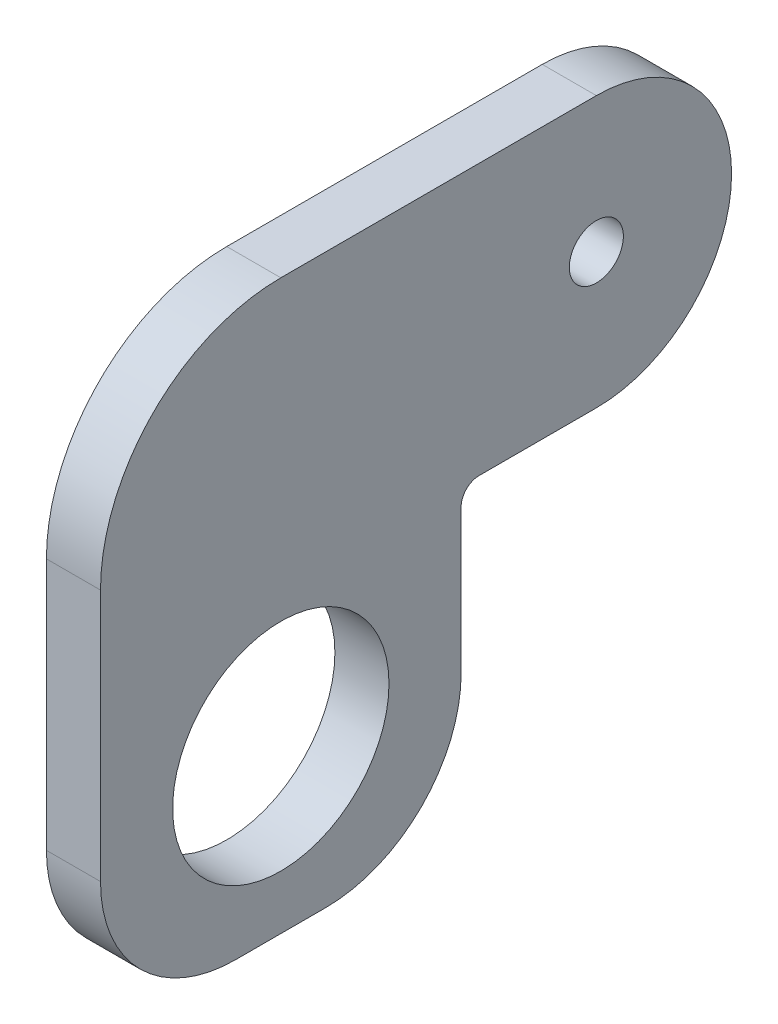
from build123d import *

# Parameters (mm, degrees)
SKETCH1_R           = 6
SKETCH1_R_2         = 1.5
BOSS_EXTRUDE1_DEPTH = 1.5
FILLET1_R           = 7.5
FILLET2_R           = 1


with BuildPart() as part:
    # Sketch1 → Boss-Extrude1 (new, symmetric)
    with BuildSketch(Plane(origin=(0, 0, 0), x_dir=(0, 0, -1), z_dir=(1, 0, 0))):
        with BuildLine():
            Line((-7.5, 7.5), (7.5, 7.5))
            Line((7.5, 7.5), (7.5, 22.5))
            Line((7.5, 22.5), (-17.5, 22.5))
            ThreePointArc((-17.5, 22.5), (-24.571067812, 19.571067812), (-27.5, 12.5))
            Line((-27.5, 12.5), (-27.5, -9))
            Line((-27.5, -9), (-7.5, -9))
            Line((-7.5, -9), (-7.5, 7.5))
        make_face()
        with Locations((-17.5, 0)):
            Circle(SKETCH1_R, mode=Mode.SUBTRACT)
        with Locations((0, 15)):
            Circle(SKETCH1_R_2, mode=Mode.SUBTRACT)
    extrude(amount=BOSS_EXTRUDE1_DEPTH, both=True)

    # Fillet1
    fillet1_edges = [part.edges().sort_by_distance(p)[0] for p in [
        (0, -9, 27.5),
        (0, -9, 7.5),
        (0, 7.5, -7.5),
        (0, 22.5, -7.5),
    ]]
    fillet(fillet1_edges, radius=FILLET1_R - 0.0001)  # a hair under: the kernel refuses the full size

    # Fillet2
    fillet2_edges = [part.edges().sort_by_distance(p)[0] for p in [
        (0, 7.5, 7.5),
    ]]
    fillet(fillet2_edges, radius=FILLET2_R)


solid = part.part
